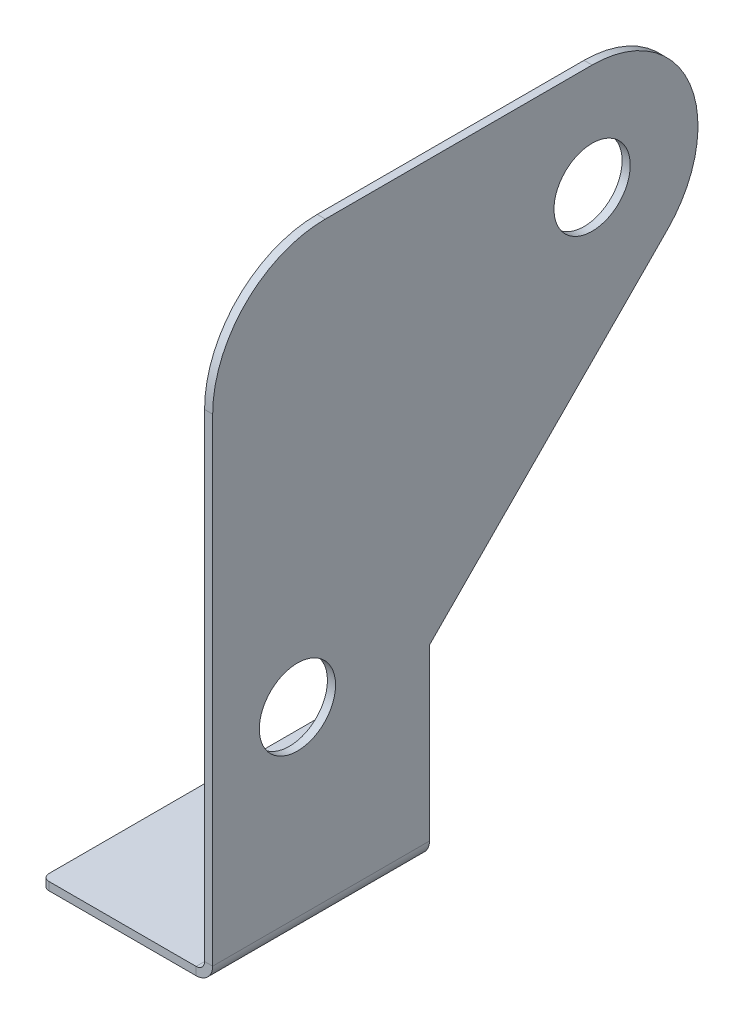
from build123d import *

# Parameters (mm, degrees)
SKETCH2_R              = 14.2875
SKETCH2_W              = 81.28
SKETCH2_H              = 3.175
BOSS_EXTRUDE1_DEPTH    = 3.175
SKETCH9_R              = 14.2875
CUT_EXTRUDE2_DEPTH     = 3.175
SKETCH2_3_W            = 81.28
SKETCH2_3_H            = 3.175
BOSS_EXTRUDE2_DEPTH    = 60.7695
BOSS_EXTRUDE3_DEPTH    = 3.175
FILLET1_R              = 2.54
FILLET2_R              = 42.2275
CONVERT_SOLID2_START   = -102
CONVERT_SOLID2_DEPTH   = 184
CONVERT_SOLID2_2_DEPTH = 81.28
UNFOLD1_START          = -51
UNFOLD1_DEPTH          = 132.28
UNFOLD1_2_DEPTH        = 78.74
UNFOLD1_START_2        = 0.13716
UNFOLD1_3_DEPTH        = 3.03784
FOLD1_START            = -58.892012294
FOLD1_OUTLINE_W        = 3.03784
FOLD1_OUTLINE_H        = 81.28
FOLD1_DEPTH            = 59.530319476
FOLD1_2_DEPTH          = 6.21284
FOLD1_START_2          = -49.557397552
FOLD1_3_DEPTH          = 131.557397552


with BuildPart() as part:
    # Sketch2 → Boss-Extrude1 (new body)
    # profile 1 of 2: a face of its own
    with BuildSketch(Plane(origin=(0, 0, 0), x_dir=(0, 0, -1), z_dir=(1, 0, 0))):
        with BuildLine():
            Line((0, 3.175), (0, 69.85))
            Line((0, 69.85), (89.183866464, 160.063269699))
            ThreePointArc((89.183866464, 160.063269699), (97.582743975, 203.257963311), (60.96, 227.65258))
            Line((60.96, 227.65258), (-81.28, 227.65258))
            Line((-81.28, 227.65258), (-81.28, 69.85))
            Line((-81.28, 69.85), (-81.28, 3.175))
            Line((-81.28, 3.175), (0, 3.175))
        make_face()
        with Locations((60.96, 187.96508)):
            Circle(SKETCH2_R, mode=Mode.SUBTRACT)
    # profile 2 of 2: a face of its own
    with BuildSketch(Plane(origin=(0, 0, 0), x_dir=(0, 0, -1), z_dir=(1, 0, 0))):
        with Locations((-40.64, 1.5875)):
            Rectangle(SKETCH2_W, SKETCH2_H)
    extrude(amount=BOSS_EXTRUDE1_DEPTH)

    # Sketch9 → Cut-Extrude2 (cut)
    with BuildSketch(Plane(origin=(0, 0, 0), x_dir=(0, 0, -1), z_dir=(1, 0, 0))):
        with Locations((-49.5046, 74.46228868)):
            Circle(SKETCH9_R)
    extrude(amount=CUT_EXTRUDE2_DEPTH, mode=Mode.SUBTRACT)

    # Sketch2<3> → Boss-Extrude2 (add)
    with BuildSketch(Plane(origin=(0, 0, 0), x_dir=(0, 0, -1), z_dir=(1, 0, 0))):
        with Locations((-40.64, 1.5875)):
            Rectangle(SKETCH2_3_W, SKETCH2_3_H)
    extrude(amount=-BOSS_EXTRUDE2_DEPTH)

    # Sketch3 → Boss-Extrude3 (add)
    with BuildSketch(Plane(origin=(0, 3.175, 0), x_dir=(1, 0, 0), z_dir=(0, 1, 0))):
        Polygon((-60.7695, 0), (-60.7695, 53.1495), (-7.62, 0), align=None)
    extrude(amount=-BOSS_EXTRUDE3_DEPTH)

    # Fillet1
    fillet1_edges = [part.edges().sort_by_distance(p)[0] for p in [
        (-60.7695, 1.5875, 81.28),
        (-60.7695, 1.5875, -53.1495),
    ]]
    fillet(fillet1_edges, radius=FILLET1_R)

    # Fillet2
    fillet2_edges = [part.edges().sort_by_distance(p)[0] for p in [
        (1.5875, 227.65258, 81.28),
    ]]
    fillet(fillet2_edges, radius=FILLET2_R)

    # Convert-Solid2: read off the stored shape, not the designer's step
    # Convert-Solid2 outline → Convert-Solid2 (cut)
    with BuildSketch(Plane.XY.offset(CONVERT_SOLID2_START)):
        with BuildLine():
            ThreePointArc((3.175, 6.21284), (1.355301294, 1.819698706), (-3.03784, 0))
            Line((-3.03784, 0), (3.175, 0))
            Line((3.175, 0), (3.175, 6.21284))
        make_face()
        with BuildLine():
            Line((-60.7695, 3.175), (-60.7695, 3.03784))
            Line((-60.7695, 3.03784), (-3.03784, 3.03784))
            ThreePointArc((-3.03784, 3.03784), (-2.571212204, 3.072317193), (-2.114718593, 3.175))
            Line((-2.114718593, 3.175), (-60.7695, 3.175))
        make_face()
        with BuildLine():
            Line((0.13716, 6.21284), (0.13716, 227.65258))
            Line((0.13716, 227.65258), (0, 227.65258))
            Line((0, 227.65258), (0, 5.289718593))
            ThreePointArc((0, 5.289718593), (0.102682807, 5.746212204), (0.13716, 6.21284))
        make_face()
    extrude(amount=CONVERT_SOLID2_DEPTH, mode=Mode.SUBTRACT)

    # Convert-Solid2 2 outline → Convert-Solid2 2 (add)
    with BuildSketch(Plane.XY):
        with BuildLine():
            ThreePointArc((0, 5.289718593), (-0.79277597, 3.96777597), (-2.114718593, 3.175))
            Line((-2.114718593, 3.175), (0, 3.175))
            Line((0, 3.175), (0, 5.289718593))
        make_face()
    extrude(amount=CONVERT_SOLID2_2_DEPTH)

    # Unfold1: read off the stored shape, not the designer's step
    # Unfold1 outline → Unfold1 (cut)
    with BuildSketch(Plane.XY.offset(UNFOLD1_START)):
        with BuildLine():
            ThreePointArc((-3.03784, 0), (-1.391483498, 0.222106228), (0.13716, 0.872544516))
            Line((0.13716, 0.872544516), (0.13716, 6.21284))
            ThreePointArc((0.13716, 6.21284), (-0.79277597, 3.96777597), (-3.03784, 3.03784))
            Line((-3.03784, 3.03784), (-60.7695, 3.03784))
            Line((-60.7695, 3.03784), (-60.7695, 0))
            Line((-60.7695, 0), (-3.03784, 0))
        make_face()
    extrude(amount=UNFOLD1_DEPTH, mode=Mode.SUBTRACT)

    # Unfold1 2 outline → Unfold1 2 (add)
    with BuildSketch(Plane.XY):
        with BuildLine():
            Line((0.13716, -58.892012294), (3.175, -58.892012294))
            Line((3.175, -58.892012294), (3.175, 6.21284))
            ThreePointArc((3.175, 6.21284), (2.362398322, 3.140901373), (0.13716, 0.872544516))
            Line((0.13716, 0.872544516), (0.13716, -58.892012294))
        make_face()
    extrude(amount=UNFOLD1_2_DEPTH)

    # Unfold1 3 outline → Unfold1 3 (add)
    with BuildSketch(Plane.YZ.offset(UNFOLD1_START_2)):
        with BuildLine():
            Line((8, 81.28), (-56.352012294, 81.28))
            ThreePointArc((-56.352012294, 81.28), (-58.148063518, 80.536051224), (-58.892012294, 78.74))
            Line((-58.892012294, 78.74), (8, 78.74))
            Line((8, 78.74), (8, 81.28))
        make_face()
        with BuildLine():
            Line((-5.742512294, 0), (-58.892012294, 0))
            Line((-58.892012294, 0), (-58.892012294, -47.017397552))
            ThreePointArc((-58.892012294, -47.017397552), (-57.324028212, -49.364051564), (-54.55596107, -48.813448776))
            Line((-54.55596107, -48.813448776), (-5.742512294, 0))
        make_face()
    extrude(amount=UNFOLD1_3_DEPTH)

    # Fold1: read off the stored shape, not the designer's step
    # Fold1 outline → Fold1 (cut)
    with BuildSketch(Plane(origin=(0, 0, 0), x_dir=(1, 0, 0), z_dir=(0, 1, 0)).offset(FOLD1_START)):
        with Locations((1.65608, -40.64)):
            Rectangle(FOLD1_OUTLINE_W, FOLD1_OUTLINE_H)
    extrude(amount=FOLD1_DEPTH, mode=Mode.SUBTRACT)

    # Fold1 2 outline → Fold1 2 (add)
    with BuildSketch(Plane(origin=(0, 0, 0), x_dir=(1, 0, 0), z_dir=(0, 1, 0))):
        with BuildLine():
            ThreePointArc((-60.7695, -78.74), (-60.025551224, -80.536051224), (-58.2295, -81.28))
            Line((-58.2295, -81.28), (0.13716, -81.28))
            Line((0.13716, -81.28), (0.13716, 0))
            Line((0.13716, 0), (-7.62, 0))
            Line((-7.62, 0), (-56.433448776, 48.813448776))
            ThreePointArc((-56.433448776, 48.813448776), (-59.201515918, 49.364051564), (-60.7695, 47.017397552))
            Line((-60.7695, 47.017397552), (-60.7695, -78.74))
        make_face()
    extrude(amount=FOLD1_2_DEPTH)

    # Fold1 3 outline → Fold1 3 (cut)
    with BuildSketch(Plane.XY.offset(FOLD1_START_2)):
        with BuildLine():
            Line((-60.7695, 6.21284), (-60.7695, 3.03784))
            Line((-60.7695, 3.03784), (-3.03784, 3.03784))
            ThreePointArc((-3.03784, 3.03784), (-0.79277597, 3.96777597), (0.13716, 6.21284))
            Line((0.13716, 6.21284), (-60.7695, 6.21284))
        make_face()
        with BuildLine():
            Line((-3.03784, 0), (-60.7695, -1.4e-08))
            Line((-60.7695, -1.4e-08), (-60.7695, -60))
            Line((-60.7695, -60), (0.13716, -60))
            Line((0.13716, -60), (0.13716, -58.892012294))
            Line((0.13716, -58.892012294), (3.175, -58.892012294))
            Line((3.175, -58.892012294), (3.175, 6.21284))
            ThreePointArc((3.175, 6.21284), (1.355301294, 1.819698706), (-3.03784, 0))
        make_face()
    extrude(amount=FOLD1_3_DEPTH, mode=Mode.SUBTRACT)


solid = part.part
